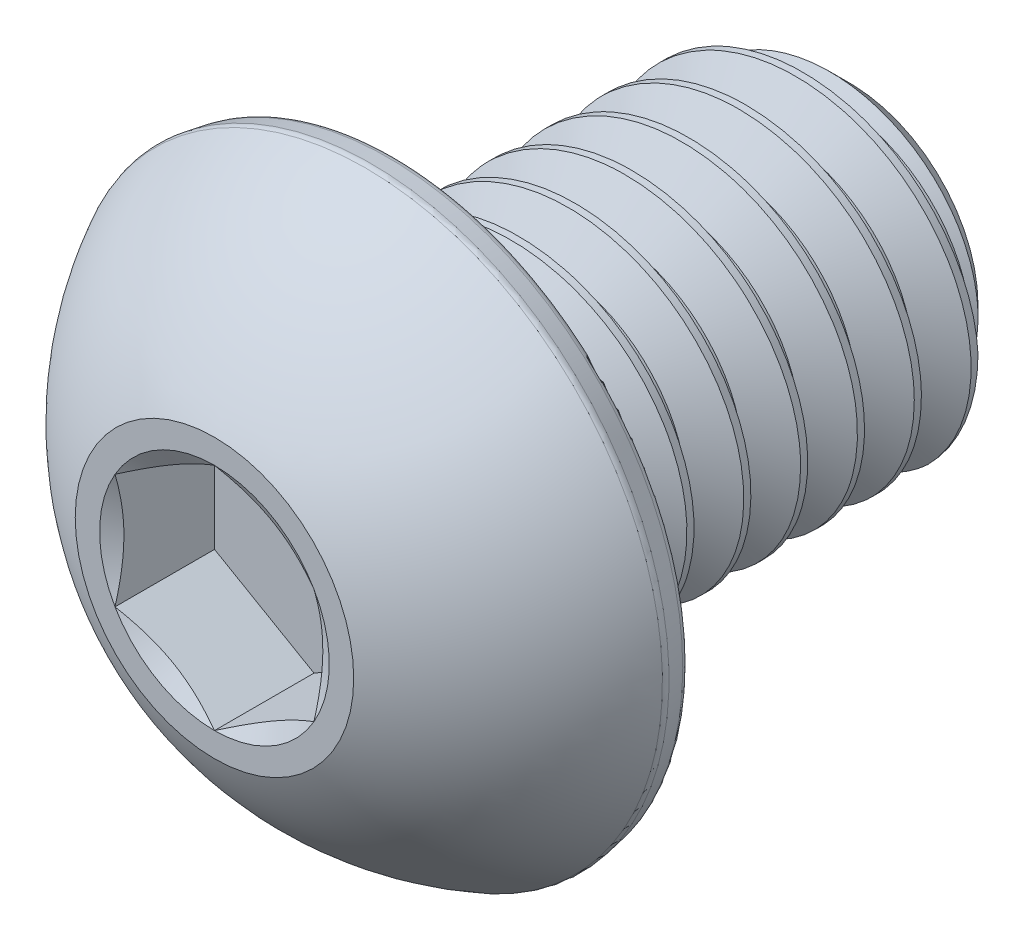
from build123d import *

# Parameters (mm, degrees)
CUT_EXTRUDE1_DEPTH = 2.78003
FILLET1_R          = 0.25273
CUT_SWEEP1_PITCH   = 1.5875
CUT_SWEEP1_TO      = 12.7


with BuildPart() as part:
    # Sketch3 → Revolve1 (revolve)
    with BuildSketch(Plane(origin=(0, 0, 0), x_dir=(0, 0, -1), z_dir=(1, 0, 0)), mode=Mode.PRIVATE) as revolve1_sk:
        with BuildLine():
            Line((-8.8773, 0), (-8.8773, 3.889375))
            ThreePointArc((-8.8773, 3.889375), (-7.108128881, 6.476912695), (-4.58089, 8.3312))
            Line((-4.58089, 8.3312), (-3.8227, 8.197510646))
            Line((-3.8227, 8.197510646), (-3.8227, 4.7625))
            Line((-3.8227, 4.7625), (7.686675, 4.7625))
            Line((7.686675, 4.7625), (8.8773, 3.571875))
            Line((8.8773, 3.571875), (8.8773, 0))
            Line((8.8773, 0), (-8.8773, 0))
        make_face()
    revolve(revolve1_sk.sketch.rotate(Axis((0, 0, 8.8773), (0, 0, -1)), 90), axis=Axis((0, 0, 8.8773), (0, 0, -1)))

    # Sketch4 → Cut-Extrude1 (cut)
    with BuildSketch(Plane.XY.offset(8.8773)):
        Polygon((-2.778125, -1.603951217), (0, -3.207902433), (2.778125, -1.603951217), (2.778125, 1.603951217), (0, 3.207902433), (-2.778125, 1.603951217), align=None)
    extrude(amount=-CUT_EXTRUDE1_DEPTH, mode=Mode.SUBTRACT)

    # Cut-Extrude2 cone 1 section (through the dimple's axis) → Cut-Extrude2 (revolve, cut)
    with BuildSketch(Plane(origin=(0, 0, 8.8773), x_dir=(0, -1, 0), z_dir=(1, 0, 0))):
        Polygon((0, 0), (3.207902433, 0), (0, 1.852083333), align=None)
    revolve(axis=Axis((0, 0, 8.8773), (0, 0, -1)), mode=Mode.SUBTRACT)

    # Fillet1
    fillet1_edges = [part.edges().sort_by_distance(p)[0] for p in [
        (-8.197510646, 0, 3.8227),
        (-8.3312, 0, 4.58089),
    ]]
    fillet(fillet1_edges, radius=FILLET1_R)


with BuildPart() as body_2:
    # Split1: read off the stored shape, not the designer's step
    # Split1: the piece on the far side of the plane
    add(part.part)
    split(bisect_by=Plane.XY.offset(3.8227), keep=Keep.BOTTOM)

    # Cut-Sweep1: arcs per turn and ends read off the stored shape
    # Cut-Sweep1: the profile of Sketch7 screwed along a right-hand helix through 9 turns, 8 arcs to a turn; built about Z, then put on its axis
    cut_sweep1_z = Axis((0, 0, 0), (0, 0, 1))
    cut_sweep1_corners = [(4.848425958, 0, 0.049609375), (4.848425958, 0, -1.438671875), (3.731388504, 0, -0.79375), (3.731388504, 0, -0.5953125)]
    with BuildLine(mode=Mode.PRIVATE) as cut_sweep1_profile:
        Line(cut_sweep1_corners[0], cut_sweep1_corners[1])
        Line(cut_sweep1_corners[1], cut_sweep1_corners[2])
        Line(cut_sweep1_corners[2], cut_sweep1_corners[3])
        Line(cut_sweep1_corners[3], cut_sweep1_corners[0])
    cut_sweep1_cap = Face(cut_sweep1_profile.wire())
    cut_sweep1_turn_angles = [0, 22.5, 45, 67.5, 90, 112.5, 135, 157.5, 180, 202.5, 225, 247.5, 270, 292.5, 315, 337.5, 360]
    cut_sweep1_turn_weights = [1, 0.9238795325112867, 1, 0.9238795325112867, 1, 0.9238795325112867, 1, 0.9238795325112867, 1, 0.9238795325112867, 1, 0.9238795325112867, 1, 0.9238795325112867, 1, 0.9238795325112867, 1]
    cut_sweep1_turn_rails = [Edge.make_bspline([Vector(p[0], p[1], 0).rotate(cut_sweep1_z, cut_sweep1_turn_angles[k]) / cut_sweep1_turn_weights[k] + Vector(0, 0, p[2] + CUT_SWEEP1_PITCH * cut_sweep1_turn_angles[k] / 360) for k in range(17)], [0, 0, 0, 1, 1, 2, 2, 3, 3, 4, 4, 5, 5, 6, 6, 7, 7, 8, 8, 8], 2, cut_sweep1_turn_weights) for p in cut_sweep1_corners]
    cut_sweep1_turn_sides = [Face.make_surface_from_curves(cut_sweep1_turn_rails[p[0]], cut_sweep1_turn_rails[p[1]]) for p in [(0, 1), (1, 2), (2, 3), (3, 0)]]
    cut_sweep1 = Plane(origin=(0, 0, -8.8773), x_dir=(0, 1, 0), z_dir=(0, 0, 1)) * split(Solid(Shell([*[p.moved(Location((0, 0, CUT_SWEEP1_PITCH * i))) for i in range(9) for p in cut_sweep1_turn_sides], cut_sweep1_cap, cut_sweep1_cap.rotate(cut_sweep1_z, 3240).moved(Location((0, 0, CUT_SWEEP1_PITCH * 3240 / 360)))])), bisect_by=Plane.XY.offset(CUT_SWEEP1_TO), keep=Keep.BOTTOM, mode=Mode.PRIVATE)
    add(cut_sweep1, mode=Mode.SUBTRACT)


with BuildPart() as part_1:
    add(part.part)

    # Split1
    split(bisect_by=Plane.XY.offset(3.8227), keep=Keep.TOP)

    add(body_2.part)  # Boss-Extrude1 merges body 2
    # Boss-Extrude1: read off the stored shape, not the designer's step
    # Boss-Extrude1 outline → Boss-Extrude1 (revolve)
    with BuildSketch(Plane.XZ):
        Polygon((3.731387384, 3.8227), (3.731387384, 2.619735468), (4.934351916, 3.8227), align=None)
    revolve(axis=Axis((0, 0, 0), (0, 0, 1)))


solid = part_1.part
